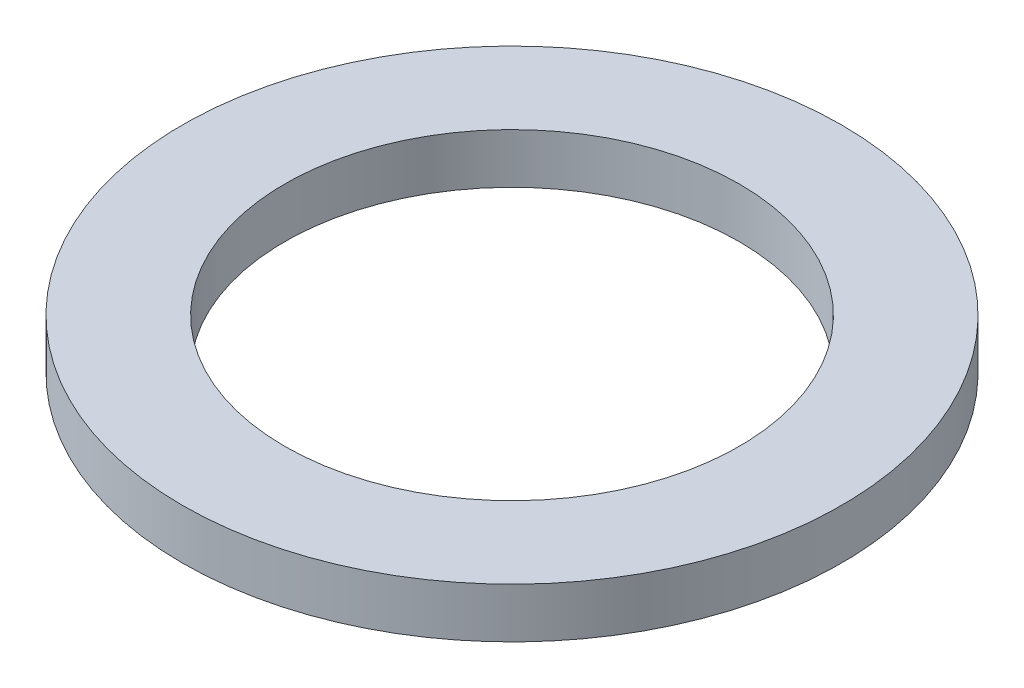
from build123d import *

# Parameters (mm, degrees)
SKETCH1_R           = 72.5
BOSS_EXTRUDE1_DEPTH = 11
SKETCH2_R           = 50
CUT_EXTRUDE1_DEPTH  = 104.118863454


with BuildPart() as part:
    # Sketch1 → Boss-Extrude1 (new body)
    with BuildSketch(Plane(origin=(0, 0, 0), x_dir=(1, 0, 0), z_dir=(0, 1, 0))):
        Circle(SKETCH1_R)
    extrude(amount=BOSS_EXTRUDE1_DEPTH)

    # Sketch2 → Cut-Extrude1 (cut, through all)
    with BuildSketch(Plane(origin=(0, 0, 0), x_dir=(1, 0, 0), z_dir=(0, 1, 0))):
        Circle(SKETCH2_R)
    extrude(amount=CUT_EXTRUDE1_DEPTH, mode=Mode.SUBTRACT)


solid = part.part
